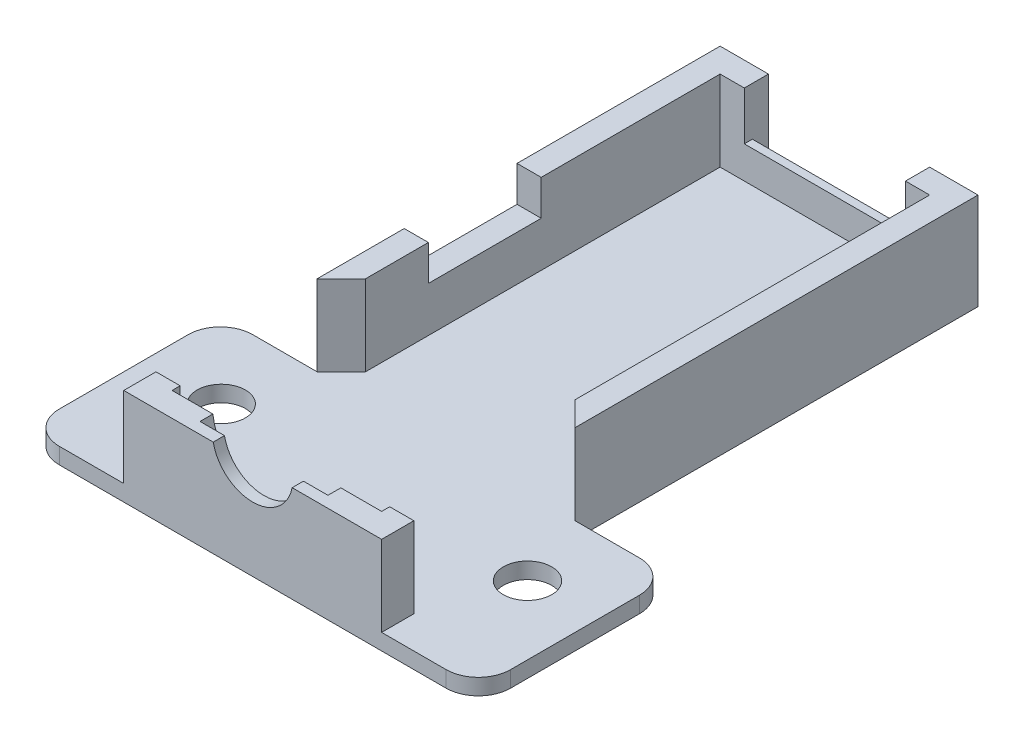
from build123d import *

# Parameters (mm, degrees)
SKETCH1_W           = 16
SKETCH1_H           = 37
SKETCH1_W_2         = 13
SKETCH1_H_2         = 34
BOSS_EXTRUDE1_DEPTH = 5
SKETCH2_W           = 16
SKETCH2_H           = 37
BOSS_EXTRUDE2_DEPTH = 1
SKETCH3_W           = 10
SKETCH3_H           = 5
CUT_EXTRUDE1_DEPTH  = 21
SKETCH4_W           = 7
SKETCH4_H           = 2.2
CUT_EXTRUDE2_DEPTH  = 2
SKETCH5_R           = 2.5
CUT_EXTRUDE3_DEPTH  = 2
SKETCH6_W           = 10
SKETCH6_H           = 3
CUT_EXTRUDE4_DEPTH  = 2
CHAMFER1_SIZE       = 1
SKETCH7_W           = 12
SKETCH7_H           = 1
BOSS_EXTRUDE3_DEPTH = 6
SKETCH8_W           = 12
SKETCH8_H           = 1
BOSS_EXTRUDE4_DEPTH = 6
FILLET1_R           = 2
SKETCH9_R           = 1.5
CUT_EXTRUDE5_DEPTH  = 6
SKETCH12_R          = 4
CUT_EXTRUDE6_DEPTH  = 0.8
CHAMFER2_SIZE       = 1.5


with BuildPart() as part:
    # Sketch1 → Boss-Extrude1 (new body)
    with BuildSketch(Plane(origin=(0, 0, 0), x_dir=(1, 0, 0), z_dir=(0, 1, 0))):
        Rectangle(SKETCH1_W, SKETCH1_H)
        Rectangle(SKETCH1_W_2, SKETCH1_H_2, mode=Mode.SUBTRACT)
    extrude(amount=BOSS_EXTRUDE1_DEPTH)

    # Sketch2 → Boss-Extrude2 (add)
    with BuildSketch(Plane.XZ):
        Rectangle(SKETCH2_W, SKETCH2_H)
    extrude(amount=BOSS_EXTRUDE2_DEPTH)

    # Sketch3 → Cut-Extrude1 (cut)
    with BuildSketch(Plane(origin=(8, 0, 0), x_dir=(0, 0, -1), z_dir=(1, 0, 0))):
        with Locations((-11.5, 2.5)):
            Rectangle(SKETCH3_W, SKETCH3_H)
    extrude(amount=-CUT_EXTRUDE1_DEPTH, mode=Mode.SUBTRACT)

    # Sketch4 → Cut-Extrude2 (cut)
    with BuildSketch(Plane.ZY.offset(8)):
        with Locations((-2.4, 3.9)):
            Rectangle(SKETCH4_W, SKETCH4_H)
    extrude(amount=-CUT_EXTRUDE2_DEPTH, mode=Mode.SUBTRACT)

    # Sketch5 → Cut-Extrude3 (cut)
    with BuildSketch(Plane.XY.offset(18.5)):
        with Locations((0, 5.5)):
            Circle(SKETCH5_R)
    extrude(amount=-CUT_EXTRUDE3_DEPTH, mode=Mode.SUBTRACT)

    # Sketch6 → Cut-Extrude4 (cut)
    with BuildSketch(Plane.XY.offset(-17)):
        with Locations((0, 3.5)):
            Rectangle(SKETCH6_W, SKETCH6_H)
    extrude(amount=-CUT_EXTRUDE4_DEPTH, mode=Mode.SUBTRACT)

    # Chamfer1
    chamfer1_edges = [part.edges().sort_by_distance(p)[0] for p in [
        (0, 2, -18.5),
    ]]
    chamfer(chamfer1_edges, length=CHAMFER1_SIZE)

    # Sketch7 → Boss-Extrude3 (add)
    with BuildSketch(Plane(origin=(8, 0, 0), x_dir=(0, 0, -1), z_dir=(1, 0, 0))):
        with Locations((-12.5, -0.5)):
            Rectangle(SKETCH7_W, SKETCH7_H)
    extrude(amount=BOSS_EXTRUDE3_DEPTH)

    # Sketch8 → Boss-Extrude4 (add)
    with BuildSketch(Plane.ZY.offset(8)):
        with Locations((12.5, -0.5)):
            Rectangle(SKETCH8_W, SKETCH8_H)
    extrude(amount=BOSS_EXTRUDE4_DEPTH)

    # Fillet1
    fillet1_edges = [part.edges().sort_by_distance(p)[0] for p in [
        (14, -0.5, 18.5),
        (14, -0.5, 6.5),
        (-14, -0.5, 18.5),
        (-14, -0.5, 6.5),
    ]]
    fillet(fillet1_edges, radius=FILLET1_R)

    # Sketch9 → Cut-Extrude5 (cut)
    with BuildSketch(Plane(origin=(0, 0, 0), x_dir=(1, 0, 0), z_dir=(0, 1, 0))):
        with Locations(Location((-9.25, -11.2, 0), (0, 0, 270))):
            Circle(SKETCH9_R)
        with Locations(Location((9.75, -11.2, 0), (0, 0, 270))):
            Circle(SKETCH9_R)
    extrude(amount=-CUT_EXTRUDE5_DEPTH, mode=Mode.SUBTRACT)

    # Sketch12 → Cut-Extrude6 (cut)
    with BuildSketch(Plane(origin=(0, 0, 17), x_dir=(-1, 0, 0), z_dir=(0, 0, -1))):
        with Locations((0, 5.5)):
            Circle(SKETCH12_R)
    extrude(amount=-CUT_EXTRUDE6_DEPTH, mode=Mode.SUBTRACT)

    # Chamfer2
    chamfer2_edges = [part.edges().sort_by_distance(p)[0] for p in [
        (6.5, 2.5, 6.5),
        (-6.5, 2.5, 6.5),
    ]]
    chamfer(chamfer2_edges, length=CHAMFER2_SIZE - 0.0001)  # a hair under: the kernel refuses the full size


solid = part.part
